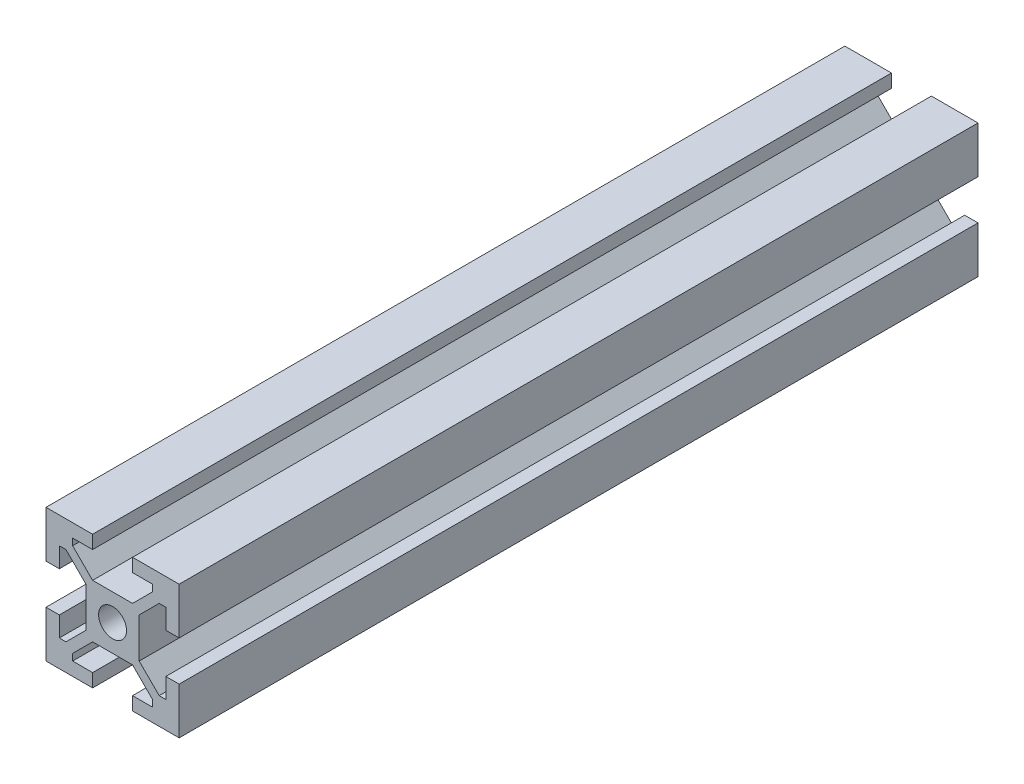
from build123d import *

# Parameters (mm, degrees)
SKETCH_2_R      = 2.1
EXTRUDE_1_DEPTH = 120


with BuildPart() as part:
    # ｽｹｯﾁ2 → ﾎﾞｽ - 押し出し1 (new body)
    with BuildSketch(Plane.XY):
        Polygon((3, 4), (-3, 4), (-6, 7), (-6, 8), (-3, 8), (-3, 10), (-10, 10), (-10, 3), (-8, 3), (-8, 6), (-7, 6), (-4, 3), (-4, -3), (-7, -6), (-8, -6), (-8, -3), (-10, -3), (-10, -10), (-3, -10), (-3, -8), (-6, -8), (-6, -7), (-3, -4), (3, -4), (6, -7), (6, -8), (3, -8), (3, -10), (10, -10), (10, -3), (8, -3), (8, -6), (7, -6), (4, -3), (4, 3), (7, 6), (8, 6), (8, 3), (10, 3), (10, 10), (3, 10), (3, 8), (6, 8), (6, 7), align=None)
        Circle(SKETCH_2_R, mode=Mode.SUBTRACT)
    extrude(amount=EXTRUDE_1_DEPTH)


solid = part.part
